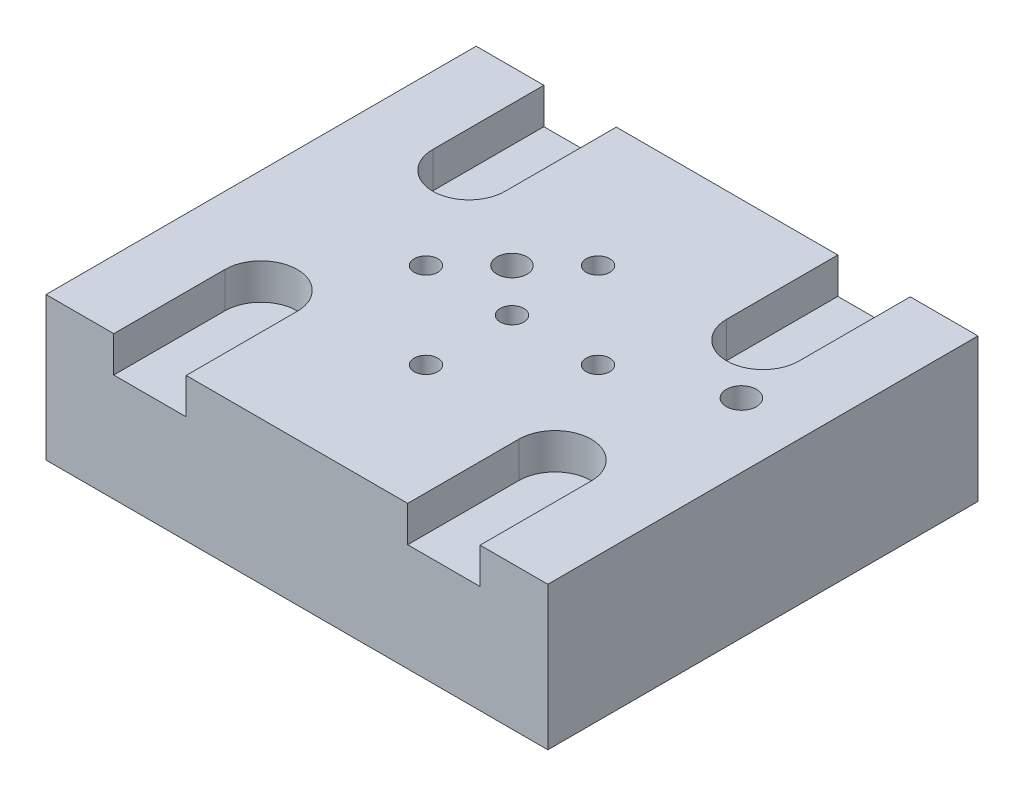
from build123d import *

# Parameters (mm, degrees)
SKETCH3_W           = 70
SKETCH3_H           = 60
BOSS_EXTRUDE3_DEPTH = 20
SKETCH4_R           = 1.65
CUT_EXTRUDE1_DEPTH  = 95.339811321
SKETCH6_R           = 2.1
CUT_EXTRUDE2_DEPTH  = 95.339811321
SKETCH9_R           = 3.25
CUT_EXTRUDE3_DEPTH  = 40.25
SKETCH11_R          = 3
CUT_EXTRUDE4_DEPTH  = 3
CHAMFER1_SIZE       = 0.8
CUT_EXTRUDE5_DEPTH  = 5


with BuildPart() as part:
    # Sketch3 → Boss-Extrude3 (new body)
    with BuildSketch(Plane(origin=(0, 0, 0), x_dir=(1, 0, 0), z_dir=(0, 1, 0))):
        with Locations((35, -30)):
            Rectangle(SKETCH3_W, SKETCH3_H)
    extrude(amount=BOSS_EXTRUDE3_DEPTH)

    # Sketch4 → Cut-Extrude1 (cut, through all)
    with BuildSketch(Plane(origin=(0, 20, 0), x_dir=(1, 0, 0), z_dir=(0, 1, 0))):
        with Locations((35, -30)):
            Circle(SKETCH4_R)
        with Locations((35, -18)):
            Circle(SKETCH4_R)
        with Locations((47, -30)):
            Circle(SKETCH4_R)
        with Locations((35, -42)):
            Circle(SKETCH4_R)
        with Locations((23, -30)):
            Circle(SKETCH4_R)
    extrude(amount=-CUT_EXTRUDE1_DEPTH, mode=Mode.SUBTRACT)

    # Sketch6 → Cut-Extrude2 (cut, through all)
    with BuildSketch(Plane.XZ):
        with Locations((61, 24)):
            Circle(SKETCH6_R)
        with Locations((29, 24)):
            Circle(SKETCH6_R)
    extrude(amount=-CUT_EXTRUDE2_DEPTH, mode=Mode.SUBTRACT)

    # Sketch9 → Cut-Extrude3 (cut)
    with BuildSketch(Plane(origin=(0, 0, 0), x_dir=(-1, 0, 0), z_dir=(0, 0, -1))):
        with Locations((-53.2, 7.5)):
            Circle(SKETCH9_R)
        with Locations((-16.732176158, 7.5)):
            Circle(SKETCH9_R)
    extrude(amount=-CUT_EXTRUDE3_DEPTH, mode=Mode.SUBTRACT)

    # Sketch11 → Cut-Extrude4 (cut)
    with BuildSketch(Plane.XZ):
        with Locations((23, 30)):
            Circle(SKETCH11_R)
        with Locations((35, 42)):
            Circle(SKETCH11_R)
        with Locations((35, 30)):
            Circle(SKETCH11_R)
        with Locations((35, 18)):
            Circle(SKETCH11_R)
        with Locations((47, 30)):
            Circle(SKETCH11_R)
    extrude(amount=-CUT_EXTRUDE4_DEPTH, mode=Mode.SUBTRACT)

    # Chamfer1
    chamfer1_edges = [part.edges().sort_by_distance(p)[0] for p in [
        (56.45, 7.5, 0),
        (19.982176158, 7.5, 0),
    ]]
    chamfer(chamfer1_edges, length=CHAMFER1_SIZE)

    # Sketch12 → Cut-Extrude5 (cut)
    with BuildSketch(Plane(origin=(0, 20, 0), x_dir=(1, 0, 0), z_dir=(0, 1, 0))):
        with BuildLine():
            Line((9.45, -60.104949747), (9.45, -44.5))
            ThreePointArc((9.45, -44.5), (14.5, -39.45), (19.55, -44.5))
            Line((19.55, -44.5), (19.55, -60.104949747))
            ThreePointArc((19.55, -60.104949747), (14.5, -65.154949747), (9.45, -60.104949747))
        make_face()
        with BuildLine():
            Line((60.55, -60.104949747), (60.55, -44.5))
            ThreePointArc((60.55, -44.5), (55.5, -39.45), (50.45, -44.5))
            Line((50.45, -44.5), (50.45, -60.104949747))
            ThreePointArc((50.45, -60.104949747), (55.5, -65.154949747), (60.55, -60.104949747))
        make_face()
        with BuildLine():
            Line((60.55, 0.104949747), (60.55, -15.5))
            ThreePointArc((60.55, -15.5), (55.5, -20.55), (50.45, -15.5))
            Line((50.45, -15.5), (50.45, 0.104949747))
            ThreePointArc((50.45, 0.104949747), (55.5, 5.154949747), (60.55, 0.104949747))
        make_face()
        with BuildLine():
            Line((9.45, 0.104949747), (9.45, -15.5))
            ThreePointArc((9.45, -15.5), (14.5, -20.55), (19.55, -15.5))
            Line((19.55, -15.5), (19.55, 0.104949747))
            ThreePointArc((19.55, 0.104949747), (14.5, 5.154949747), (9.45, 0.104949747))
        make_face()
    extrude(amount=-CUT_EXTRUDE5_DEPTH, mode=Mode.SUBTRACT)


solid = part.part
